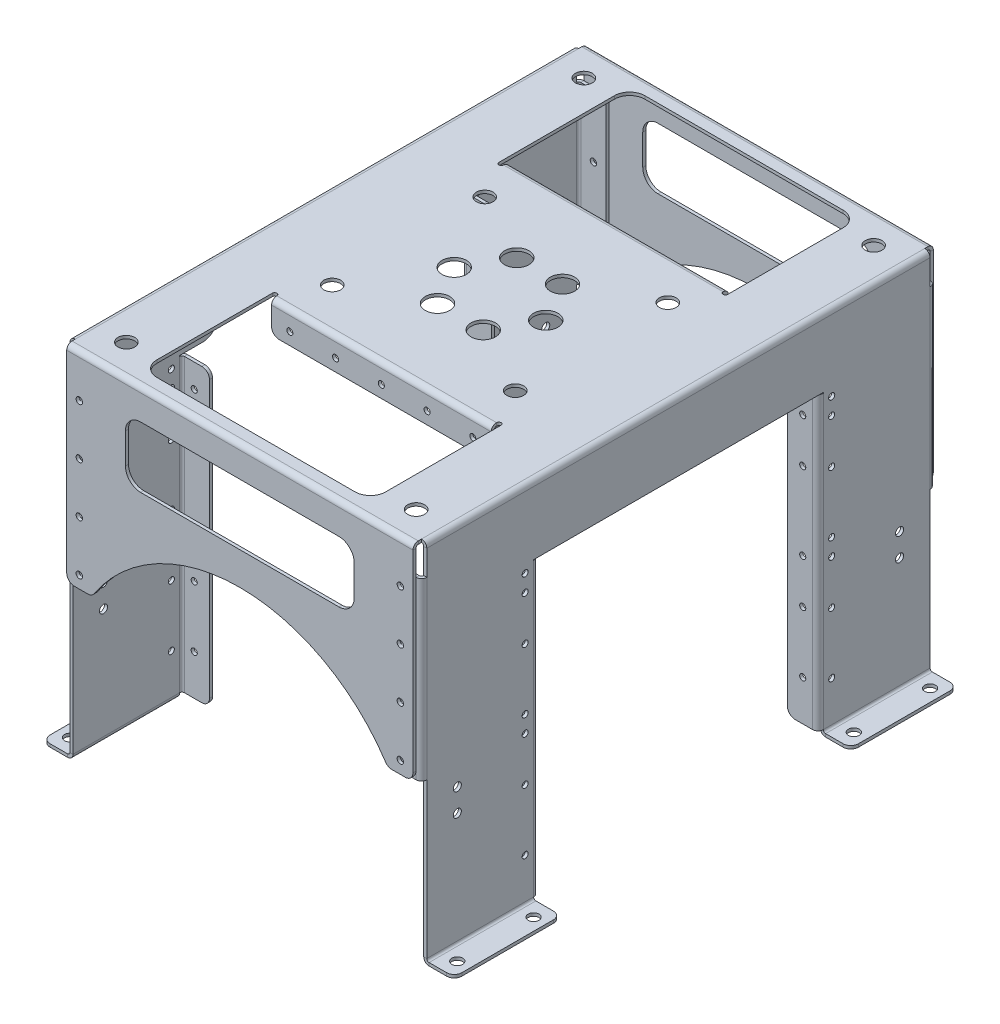
from build123d import *

# Parameters (mm, degrees)
SM_BASE_FLANGE_1_DEPTH           = 165
SM_EDGE_FLANGE_1_DEPTH           = 115
SM_EDGE_FLANGE_1_BEND_DEPTH      = 115
SM_EDGE_FLANGE_1_BEND_2_DEPTH    = 115
SM_EDGE_FLANGE_1_BEND_3_DEPTH    = 115
SM_EDGE_FLANGE_3_DEPTH           = 227
SM_START                         = 2
SM_EDGE_FLANGE_3_FLAT_DEPTH      = 2
HOLE_WIZARD_4_2_4_2_1_AT_2_COUNT = 2
HOLE_WIZARD_4_2_4_2_1_AT_2_PITCH = 33
HOLE_WIZARD_4_2_4_2_1_AT_3_COUNT = 2
HOLE_WIZARD_4_2_4_2_1_AT_3_PITCH = 66
HOLE_WIZARD_4_2_4_2_1_AT_4_COUNT = 2
HOLE_WIZARD_4_2_4_2_1_AT_4_PITCH = 99
HOLE_WIZARD_4_2_4_2_1_AT_5_COUNT = 2
HOLE_WIZARD_4_2_4_2_1_AT_5_PITCH = 232.618249499
HOLE_WIZARD_4_2_4_2_1_AT_6_COUNT = 2
HOLE_WIZARD_4_2_4_2_1_AT_6_PITCH = 220.60428373
HOLE_WIZARD_4_2_4_2_1_AT_7_COUNT = 2
HOLE_WIZARD_4_2_4_2_1_AT_7_PITCH = 213.070997557
HOLE_WIZARD_4_2_4_2_1_AT_8_COUNT = 2
HOLE_WIZARD_4_2_4_2_1_AT_8_PITCH = 210.5
F_11_DIAMETER_HOLE3_D            = 11
F_11_DIAMETER_HOLE3_DEPTH        = 5
F_11_DIAMETER_HOLE3_TIP          = 3.304733405
CUT_EXTRUDE_3_DEPTH              = 324.928016695
CUT_EXTRUDE_3_DEPTH_BACK         = 324.928016695
SKETCH_29_W                      = 190
SKETCH_29_H                      = 195
HOLE_WIZARD_M51_AT_2_COUNT       = 2
HOLE_WIZARD_M51_AT_2_PITCH       = 15
HOLE_WIZARD_M51_AT_3_COUNT       = 2
HOLE_WIZARD_M51_AT_3_PITCH       = 290
HOLE_WIZARD_M51_AT_4_COUNT       = 2
HOLE_WIZARD_M51_AT_4_PITCH       = 290.387671915
SM_EDGE_FLANGE_2_DEPTH           = 191
SM_EDGE_FLANGE_2_BEND_DEPTH      = 191
SM_EDGE_FLANGE_2_BEND_2_DEPTH    = 191
SM_EDGE_FLANGE_2_BEND_3_DEPTH    = 191
FILLET_1_R                       = 5
HOLE_WIZARD_7_1_7_1_1_D          = 7.1
HOLE_WIZARD_7_1_7_1_1_DEPTH      = 5
HOLE_WIZARD_7_1_7_1_1_TIP        = 2.133055198
CUT_EXTRUDE_6_DEPTH              = 439.454604264
CUT_EXTRUDE_7_DEPTH              = 10
F_11_DIAMETER_HOLE4_D            = 11
SKETCH_86_R                      = 8
CUT_EXTRUDE_8_DEPTH              = 10
HOLE_WIZARD_4_0_4_1_D            = 4
HOLE_WIZARD_4_0_4_1_DEPTH        = 10
HOLE_WIZARD_4_0_4_1_TIP          = 1.201721238
OTHER_START                      = 77.44041
OTHER_1_OUTLINE_W                = 144
OTHER_1_OUTLINE_H                = 2
OTHER_1_DEPTH                    = 17.55959
OTHER_START_2                    = 75.8
OTHER_1_2_OUTLINE_R              = 2
OTHER_1_2_DEPTH                  = 1.65959
OTHER_START_3                    = 74.3
OTHER_1_3_OUTLINE_R              = 2
OTHER_1_3_DEPTH                  = 3.5
OTHER_1_4_OUTLINE_W              = 144
OTHER_1_4_OUTLINE_H              = 2
OTHER_1_4_DEPTH                  = 0.14835
OTHER_START_4                    = -72
OTHER_1_5_DEPTH                  = 144
OTHER_START_5                    = -95
OTHER_2_OUTLINE_W                = 144
OTHER_2_OUTLINE_H                = 2
OTHER_2_DEPTH                    = 17.55959
OTHER_START_6                    = -77.45959
OTHER_2_2_OUTLINE_R              = 2
OTHER_2_2_DEPTH                  = 1.65959
OTHER_START_7                    = -77.8
OTHER_2_3_OUTLINE_R              = 2
OTHER_2_3_DEPTH                  = 3.5
OTHER_START_8                    = -77.58876
OTHER_2_4_OUTLINE_W              = 144
OTHER_2_4_OUTLINE_H              = 2
OTHER_2_4_DEPTH                  = 0.14835
OTHER_2_5_DEPTH                  = 144
HOLE_WIZARD_4_0_4_2_D            = 4
HOLE_START                       = -93.5
HOLE_WIZARD_4_0_4_3_OUTLINE_R    = 2
HOLE_WIZARD_4_0_4_3_DEPTH        = 187
SKETCH_106_W                     = 140
SKETCH_106_H                     = 30
CUT_EXTRUDE_10_DEPTH             = 10
FILLET_2_R                       = 10


with BuildPart() as part:
    # Базовая кромка1: sheet metal written as solids
    # Sketch 1 → Базовая кромка1 (new, symmetric)
    with BuildSketch(Plane.XY):
        with BuildLine():
            Line((-135, 0), (-118.5, 0))
            ThreePointArc((-118.5, 0), (-116.025126266, 1.025126266), (-115, 3.5))
            Line((-115, 3.5), (-115, 236.5))
            ThreePointArc((-115, 236.5), (-114.560660172, 237.560660172), (-113.5, 238))
            Line((-113.5, 238), (113.5, 238))
            ThreePointArc((113.5, 238), (114.560660172, 237.560660172), (115, 236.5))
            Line((115, 236.5), (115, 3.5))
            ThreePointArc((115, 3.5), (116.025126266, 1.025126266), (118.5, 0))
            Line((118.5, 0), (135, 0))
            Line((135, 0), (135, 2))
            Line((135, 2), (118.5, 2))
            ThreePointArc((118.5, 2), (117.439339828, 2.439339828), (117, 3.5))
            Line((117, 3.5), (117, 236.5))
            ThreePointArc((117, 236.5), (115.974873734, 238.974873734), (113.5, 240))
            Line((113.5, 240), (-113.5, 240))
            ThreePointArc((-113.5, 240), (-115.974873734, 238.974873734), (-117, 236.5))
            Line((-117, 236.5), (-117, 3.5))
            ThreePointArc((-117, 3.5), (-117.439339828, 2.439339828), (-118.5, 2))
            Line((-118.5, 2), (-135, 2))
            Line((-135, 2), (-135, 0))
        make_face()
    extrude(amount=SM_BASE_FLANGE_1_DEPTH, both=True)

    # Ребро-кромка1: sheet metal written as solids
    # Ребро-кромка1 section (on a plane across the edge) → Ребро-кромка1 (add)
    with BuildSketch(Plane(origin=(-115, 220, 166.5), x_dir=(0, 0, -1), z_dir=(0, -1, 0))):
        with BuildLine():
            Line((-2, 1.5), (-2, 18))
            Line((-2, 18), (0, 18))
            Line((0, 18), (0, 1.5))
            ThreePointArc((0, 1.5), (0.439339828, 0.439339828), (1.5, 0))
            Line((1.5, 0), (1.5, -2))
            ThreePointArc((1.5, -2), (-0.974873734, -0.974873734), (-2, 1.5))
        make_face()
    extrude(amount=SM_EDGE_FLANGE_1_DEPTH)

    # Ребро-кромка1 section 2 (on a plane across the edge) → Ребро-кромка1 bend (add)
    with BuildSketch(Plane(origin=(115, 105, 166.5), x_dir=(0, 0, -1), z_dir=(0, 1, 0))):
        with BuildLine():
            Line((-2, 1.5), (-2, 18))
            Line((-2, 18), (0, 18))
            Line((0, 18), (0, 1.5))
            ThreePointArc((0, 1.5), (0.439339828, 0.439339828), (1.5, 0))
            Line((1.5, 0), (1.5, -2))
            ThreePointArc((1.5, -2), (-0.974873734, -0.974873734), (-2, 1.5))
        make_face()
    extrude(amount=SM_EDGE_FLANGE_1_BEND_DEPTH)

    # Ребро-кромка1 section 3 (on a plane across the edge) → Ребро-кромка1 bend 2 (add)
    with BuildSketch(Plane(origin=(115, 220, -166.5), x_dir=(0, 0, 1), z_dir=(0, -1, 0))):
        with BuildLine():
            Line((-2, 1.5), (-2, 18))
            Line((-2, 18), (0, 18))
            Line((0, 18), (0, 1.5))
            ThreePointArc((0, 1.5), (0.439339828, 0.439339828), (1.5, 0))
            Line((1.5, 0), (1.5, -2))
            ThreePointArc((1.5, -2), (-0.974873734, -0.974873734), (-2, 1.5))
        make_face()
    extrude(amount=SM_EDGE_FLANGE_1_BEND_2_DEPTH)

    # Ребро-кромка1 section 4 (on a plane across the edge) → Ребро-кромка1 bend 3 (add)
    with BuildSketch(Plane(origin=(-115, 105, -166.5), x_dir=(0, 0, 1), z_dir=(0, 1, 0))):
        with BuildLine():
            Line((-2, 1.5), (-2, 18))
            Line((-2, 18), (0, 18))
            Line((0, 18), (0, 1.5))
            ThreePointArc((0, 1.5), (0.439339828, 0.439339828), (1.5, 0))
            Line((1.5, 0), (1.5, -2))
            ThreePointArc((1.5, -2), (-0.974873734, -0.974873734), (-2, 1.5))
        make_face()
    extrude(amount=SM_EDGE_FLANGE_1_BEND_3_DEPTH)

    # Ребро-кромка3: sheet metal written as solids
    # Ребро-кромка3 bend section (on a plane across the edge) → Ребро-кромка3 (add)
    with BuildSketch(Plane(origin=(113.5, 238, 168.6), x_dir=(0, 0, -1), z_dir=(-1, 0, 0))):
        with BuildLine():
            Line((-2, 1.5), (0, 1.5))
            ThreePointArc((0, 1.5), (0.439339828, 0.439339828), (1.5, 0))
            Line((1.5, 0), (3.6, 0))
            Line((3.6, 0), (3.6, -2))
            Line((3.6, -2), (1.5, -2))
            ThreePointArc((1.5, -2), (-0.974873734, -0.974873734), (-2, 1.5))
        make_face()
    sm_edge_flange_3 = extrude(amount=SM_EDGE_FLANGE_3_DEPTH)

    # Ребро-кромка3 profile (on flange) → Ребро-кромка3 flat (add)
    with BuildSketch(Plane(origin=(0, 238, 168.6), x_dir=(-1, 0, 0), z_dir=(0, 0, 1)).offset(SM_START)):
        with BuildLine():
            Line((-113.5, 1.5), (113.5, 1.5))
            Line((113.5, 1.5), (113.5, 128))
            ThreePointArc((113.5, 128), (112.035533906, 131.535533906), (108.5, 133))
            Line((108.5, 133), (99.72392953, 133))
            ThreePointArc((99.72392953, 133), (97.357241681, 132.404405593), (95.554388251, 130.759515451))
            ThreePointArc((95.554388251, 130.759515451), (0, 79.413787915), (-95.554388251, 130.759515451))
            ThreePointArc((-95.554388251, 130.759515451), (-97.357241681, 132.404405593), (-99.72392953, 133))
            Line((-99.72392953, 133), (-108.5, 133))
            ThreePointArc((-108.5, 133), (-112.035533906, 131.535533906), (-113.5, 128))
            Line((-113.5, 128), (-113.5, 1.5))
        make_face()
    sm_edge_flange_3_flat = extrude(amount=-SM_EDGE_FLANGE_3_FLAT_DEPTH)

    # Эскиз83 → Диаметр отверстия Ø4.2 (4.2)1 (revolve, cut)
    with BuildSketch(Plane(origin=(-105.25, 212, 170.6), x_dir=(0, -1, 0), z_dir=(1, 0, 0))):
        Polygon((0, 0), (0, 8.5118073), (2.1, 7.25), (2.1, 0), align=None)
    hole_wizard_4_2_4_2_1 = revolve(axis=Axis((-105.25, 212, 176.95), (0, 0, -1)), mode=Mode.SUBTRACT)

    # Диаметр отверстия Ø4.2 (4.2)1 at 2: Диаметр отверстия Ø4.2 (4.2)1 ×2
    with Locations(*[(0, -i * HOLE_WIZARD_4_2_4_2_1_AT_2_PITCH, 0) for i in range(1, HOLE_WIZARD_4_2_4_2_1_AT_2_COUNT)]):
        add(hole_wizard_4_2_4_2_1, mode=Mode.SUBTRACT)

    # Диаметр отверстия Ø4.2 (4.2)1 at 3: Диаметр отверстия Ø4.2 (4.2)1 ×2
    with Locations(*[(0, -i * HOLE_WIZARD_4_2_4_2_1_AT_3_PITCH, 0) for i in range(1, HOLE_WIZARD_4_2_4_2_1_AT_3_COUNT)]):
        add(hole_wizard_4_2_4_2_1, mode=Mode.SUBTRACT)

    # Диаметр отверстия Ø4.2 (4.2)1 at 4: Диаметр отверстия Ø4.2 (4.2)1 ×2
    with Locations(*[(0, -i * HOLE_WIZARD_4_2_4_2_1_AT_4_PITCH, 0) for i in range(1, HOLE_WIZARD_4_2_4_2_1_AT_4_COUNT)]):
        add(hole_wizard_4_2_4_2_1, mode=Mode.SUBTRACT)

    # Диаметр отверстия Ø4.2 (4.2)1 at 5: Диаметр отверстия Ø4.2 (4.2)1 ×2
    with Locations(*[Vector(0.9049161037593685, -0.42558999654240454, 0) * (i * HOLE_WIZARD_4_2_4_2_1_AT_5_PITCH) for i in range(1, HOLE_WIZARD_4_2_4_2_1_AT_5_COUNT)]):
        add(hole_wizard_4_2_4_2_1, mode=Mode.SUBTRACT)

    # Диаметр отверстия Ø4.2 (4.2)1 at 6: Диаметр отверстия Ø4.2 (4.2)1 ×2
    with Locations(*[Vector(0.9541972460411989, -0.2991782339131506, 0) * (i * HOLE_WIZARD_4_2_4_2_1_AT_6_PITCH) for i in range(1, HOLE_WIZARD_4_2_4_2_1_AT_6_COUNT)]):
        add(hole_wizard_4_2_4_2_1, mode=Mode.SUBTRACT)

    # Диаметр отверстия Ø4.2 (4.2)1 at 7: Диаметр отверстия Ø4.2 (4.2)1 ×2
    with Locations(*[Vector(0.9879336109248628, -0.15487795325662687, 0) * (i * HOLE_WIZARD_4_2_4_2_1_AT_7_PITCH) for i in range(1, HOLE_WIZARD_4_2_4_2_1_AT_7_COUNT)]):
        add(hole_wizard_4_2_4_2_1, mode=Mode.SUBTRACT)

    # Диаметр отверстия Ø4.2 (4.2)1 at 8: Диаметр отверстия Ø4.2 (4.2)1 ×2
    with Locations(*[(i * HOLE_WIZARD_4_2_4_2_1_AT_8_PITCH, 0, 0) for i in range(1, HOLE_WIZARD_4_2_4_2_1_AT_8_COUNT)]):
        add(hole_wizard_4_2_4_2_1, mode=Mode.SUBTRACT)

    # Зеркальное отражение3: Ребро-кромка3, Ребро-кромка3 flat, Диаметр отверстия Ø4.2 (4.2)1 across plane
    add(sm_edge_flange_3.mirror(Plane.XY))
    add(sm_edge_flange_3_flat.mirror(Plane.XY))
    add(hole_wizard_4_2_4_2_1.mirror(Plane.XY), mode=Mode.SUBTRACT)

    # Зеркальное отражение3 copy 1 sketch → Зеркальное отражение3 copy 1 (revolve, cut)
    with BuildSketch(Plane(origin=(-105.25, 179, -170.6), x_dir=(0, -1, 0), z_dir=(1, 0, 0))):
        Polygon((0, 0), (0, -8.5118073), (2.1, -7.25), (2.1, 0), align=None)
    revolve(axis=Axis((-105.25, 179, -176.95), (0, 0, -1)), mode=Mode.SUBTRACT)

    # Зеркальное отражение3 copy 2 sketch → Зеркальное отражение3 copy 2 (revolve, cut)
    with BuildSketch(Plane(origin=(-105.25, 146, -170.6), x_dir=(0, -1, 0), z_dir=(1, 0, 0))):
        Polygon((0, 0), (0, -8.5118073), (2.1, -7.25), (2.1, 0), align=None)
    revolve(axis=Axis((-105.25, 146, -176.95), (0, 0, -1)), mode=Mode.SUBTRACT)

    # Зеркальное отражение3 copy 3 sketch → Зеркальное отражение3 copy 3 (revolve, cut)
    with BuildSketch(Plane(origin=(-105.25, 113, -170.6), x_dir=(0, -1, 0), z_dir=(1, 0, 0))):
        Polygon((0, 0), (0, -8.5118073), (2.1, -7.25), (2.1, 0), align=None)
    revolve(axis=Axis((-105.25, 113, -176.95), (0, 0, -1)), mode=Mode.SUBTRACT)

    # Зеркальное отражение3 copy 4 sketch → Зеркальное отражение3 copy 4 (revolve, cut)
    with BuildSketch(Plane(origin=(105.25, 113, -170.6), x_dir=(0, -1, 0), z_dir=(1, 0, 0))):
        Polygon((0, 0), (0, -8.5118073), (2.1, -7.25), (2.1, 0), align=None)
    revolve(axis=Axis((105.25, 113, -176.95), (0, 0, -1)), mode=Mode.SUBTRACT)

    # Зеркальное отражение3 copy 5 sketch → Зеркальное отражение3 copy 5 (revolve, cut)
    with BuildSketch(Plane(origin=(105.25, 146, -170.6), x_dir=(0, -1, 0), z_dir=(1, 0, 0))):
        Polygon((0, 0), (0, -8.5118073), (2.1, -7.25), (2.1, 0), align=None)
    revolve(axis=Axis((105.25, 146, -176.95), (0, 0, -1)), mode=Mode.SUBTRACT)

    # Зеркальное отражение3 copy 6 sketch → Зеркальное отражение3 copy 6 (revolve, cut)
    with BuildSketch(Plane(origin=(105.25, 179, -170.6), x_dir=(0, -1, 0), z_dir=(1, 0, 0))):
        Polygon((0, 0), (0, -8.5118073), (2.1, -7.25), (2.1, 0), align=None)
    revolve(axis=Axis((105.25, 179, -176.95), (0, 0, -1)), mode=Mode.SUBTRACT)

    # Зеркальное отражение3 copy 7 sketch → Зеркальное отражение3 copy 7 (revolve, cut)
    with BuildSketch(Plane(origin=(105.25, 212, -170.6), x_dir=(0, -1, 0), z_dir=(1, 0, 0))):
        Polygon((0, 0), (0, -8.5118073), (2.1, -7.25), (2.1, 0), align=None)
    revolve(axis=Axis((105.25, 212, -176.95), (0, 0, -1)), mode=Mode.SUBTRACT)

    # 11_ Diameter Hole3
    with Locations(Plane(origin=(0, 240, 0), x_dir=(1, 0, 0), z_dir=(0, 1, 0))):
        with Locations((60, 50), (60, -50), (-60, 50), (-60, -50)):
            Hole(F_11_DIAMETER_HOLE3_D / 2, depth=F_11_DIAMETER_HOLE3_DEPTH)
            with Locations((0, 0, -(F_11_DIAMETER_HOLE3_DEPTH + F_11_DIAMETER_HOLE3_TIP / 2))):  # 118° drill point
                Cone(0, F_11_DIAMETER_HOLE3_D / 2, F_11_DIAMETER_HOLE3_TIP, mode=Mode.SUBTRACT)

    # Эскиз29 → Вырез-Вытянуть3 (cut, two sides: drawn at the far end of the back side and taken through both)
    with BuildSketch(Plane(origin=(0, 0, 0), x_dir=(0, 0, -1), z_dir=(1, 0, 0)).offset(-CUT_EXTRUDE_3_DEPTH_BACK)):
        with Locations((0, 97.5)):
            Rectangle(SKETCH_29_W, SKETCH_29_H)
    extrude(amount=CUT_EXTRUDE_3_DEPTH + CUT_EXTRUDE_3_DEPTH_BACK, mode=Mode.SUBTRACT)

    # Эскиз33 → Отверстие с зазором M51 (revolve, cut)
    with BuildSketch(Plane(origin=(117, 91, 145), x_dir=(0, 0, -1), z_dir=(0, 1, 0))):
        Polygon((0, 0), (0, 6.59228064), (2.65, 5), (2.65, 0), align=None)
    hole_wizard_m51 = revolve(axis=Axis((123.35, 91, 145), (-1, 0, 0)), mode=Mode.SUBTRACT)

    # Отверстие с зазором M51 at 2: Отверстие с зазором M51 ×2
    with Locations(*[(0, -i * HOLE_WIZARD_M51_AT_2_PITCH, 0) for i in range(1, HOLE_WIZARD_M51_AT_2_COUNT)]):
        add(hole_wizard_m51, mode=Mode.SUBTRACT)

    # Отверстие с зазором M51 at 3: Отверстие с зазором M51 ×2
    with Locations(*[(0, 0, -i * HOLE_WIZARD_M51_AT_3_PITCH) for i in range(1, HOLE_WIZARD_M51_AT_3_COUNT)]):
        add(hole_wizard_m51, mode=Mode.SUBTRACT)

    # Отверстие с зазором M51 at 4: Отверстие с зазором M51 ×2
    with Locations(*[Vector(0, -0.0516550854280424, -0.9986649849421084) * (i * HOLE_WIZARD_M51_AT_4_PITCH) for i in range(1, HOLE_WIZARD_M51_AT_4_COUNT)]):
        add(hole_wizard_m51, mode=Mode.SUBTRACT)

    # Зеркальное отражение2: Отверстие с зазором M51 across plane
    add(hole_wizard_m51.mirror(Plane(origin=(0, 0, 0), x_dir=(0, 0, 1), z_dir=(1, 0, 0))), mode=Mode.SUBTRACT)

    # Зеркальное отражение2 copy 1 sketch → Зеркальное отражение2 copy 1 (revolve, cut)
    with BuildSketch(Plane(origin=(-117, 76, 145), x_dir=(0, 0, -1), z_dir=(0, 1, 0))):
        Polygon((0, 0), (0, -6.59228064), (2.65, -5), (2.65, 0), align=None)
    revolve(axis=Axis((-123.35, 76, 145), (-1, 0, 0)), mode=Mode.SUBTRACT)

    # Зеркальное отражение2 copy 2 sketch → Зеркальное отражение2 copy 2 (revolve, cut)
    with BuildSketch(Plane(origin=(-117, 91, -145), x_dir=(0, 0, -1), z_dir=(0, 1, 0))):
        Polygon((0, 0), (0, -6.59228064), (2.65, -5), (2.65, 0), align=None)
    revolve(axis=Axis((-123.35, 91, -145), (-1, 0, 0)), mode=Mode.SUBTRACT)

    # Зеркальное отражение2 copy 3 sketch → Зеркальное отражение2 copy 3 (revolve, cut)
    with BuildSketch(Plane(origin=(-117, 76, -145), x_dir=(0, 0, -1), z_dir=(0, 1, 0))):
        Polygon((0, 0), (0, -6.59228064), (2.65, -5), (2.65, 0), align=None)
    revolve(axis=Axis((-123.35, 76, -145), (-1, 0, 0)), mode=Mode.SUBTRACT)

    # Ребро-кромка2: sheet metal written as solids
    # Ребро-кромка2 section (on a plane across the edge) → Ребро-кромка2 (add)
    with BuildSketch(Plane(origin=(115, 3.5, -93.5), x_dir=(0, 0, -1), z_dir=(0, 1, 0))):
        with BuildLine():
            Line((-2, 1.5), (-2, 18))
            Line((-2, 18), (0, 18))
            Line((0, 18), (0, 1.5))
            ThreePointArc((0, 1.5), (0.439339828, 0.439339828), (1.5, 0))
            Line((1.5, 0), (1.5, -2))
            ThreePointArc((1.5, -2), (-0.974873734, -0.974873734), (-2, 1.5))
        make_face()
    extrude(amount=SM_EDGE_FLANGE_2_DEPTH)

    # Ребро-кромка2 section 2 (on a plane across the edge) → Ребро-кромка2 bend (add)
    with BuildSketch(Plane(origin=(-115, 194.5, -93.5), x_dir=(0, 0, -1), z_dir=(0, -1, 0))):
        with BuildLine():
            Line((-2, 1.5), (-2, 18))
            Line((-2, 18), (0, 18))
            Line((0, 18), (0, 1.5))
            ThreePointArc((0, 1.5), (0.439339828, 0.439339828), (1.5, 0))
            Line((1.5, 0), (1.5, -2))
            ThreePointArc((1.5, -2), (-0.974873734, -0.974873734), (-2, 1.5))
        make_face()
    extrude(amount=SM_EDGE_FLANGE_2_BEND_DEPTH)

    # Ребро-кромка2 section 3 (on a plane across the edge) → Ребро-кромка2 bend 2 (add)
    with BuildSketch(Plane(origin=(-115, 3.5, 93.5), x_dir=(0, 0, 1), z_dir=(0, 1, 0))):
        with BuildLine():
            Line((-2, 1.5), (-2, 18))
            Line((-2, 18), (0, 18))
            Line((0, 18), (0, 1.5))
            ThreePointArc((0, 1.5), (0.439339828, 0.439339828), (1.5, 0))
            Line((1.5, 0), (1.5, -2))
            ThreePointArc((1.5, -2), (-0.974873734, -0.974873734), (-2, 1.5))
        make_face()
    extrude(amount=SM_EDGE_FLANGE_2_BEND_2_DEPTH)

    # Ребро-кромка2 section 4 (on a plane across the edge) → Ребро-кромка2 bend 3 (add)
    with BuildSketch(Plane(origin=(115, 194.5, 93.5), x_dir=(0, 0, 1), z_dir=(0, -1, 0))):
        with BuildLine():
            Line((-2, 1.5), (-2, 18))
            Line((-2, 18), (0, 18))
            Line((0, 18), (0, 1.5))
            ThreePointArc((0, 1.5), (0.439339828, 0.439339828), (1.5, 0))
            Line((1.5, 0), (1.5, -2))
            ThreePointArc((1.5, -2), (-0.974873734, -0.974873734), (-2, 1.5))
        make_face()
    extrude(amount=SM_EDGE_FLANGE_2_BEND_3_DEPTH)

    # Скругление1
    fillet_1_edges = [part.edges().sort_by_distance(p)[0] for p in [
        (97, 105, 167.5),
        (97, 105, -167.5),
        (-97, 105, -167.5),
        (-135, 1, -165),
        (135, 1, -165),
        (-135, 1, 165),
        (-135, 1, 95),
        (-135, 1, -95),
        (135, 1, -95),
        (135, 1, 95),
        (97, 3.5, -92.5),
        (97, 194.5, -92.5),
        (-97, 194.5, -92.5),
        (-97, 3.5, -92.5),
        (-97, 3.5, 92.5),
        (-97, 194.5, 92.5),
        (97, 194.5, 92.5),
        (97, 3.5, 92.5),
        (135, 1, 165),
        (-97, 105, 167.5),
    ]]
    fillet(fillet_1_edges, radius=FILLET_1_R)

    # Диаметр отверстия Ø7.1 (7.1)1
    with Locations(Plane(origin=(0, 2, 0), x_dir=(1, 0, 0), z_dir=(0, 1, 0))):
        with Locations((127, 155), (127, 105), (127, -105), (127, -155), (-127, 155), (-127, 105), (-127, -105), (-127, -155)):
            Hole(HOLE_WIZARD_7_1_7_1_1_D / 2, depth=HOLE_WIZARD_7_1_7_1_1_DEPTH)
            with Locations((0, 0, -(HOLE_WIZARD_7_1_7_1_1_DEPTH + HOLE_WIZARD_7_1_7_1_1_TIP / 2))):  # 118° drill point
                Cone(0, HOLE_WIZARD_7_1_7_1_1_D / 2, HOLE_WIZARD_7_1_7_1_1_TIP, mode=Mode.SUBTRACT)

    # Эскиз80 → Вырез-Вытянуть6 (cut, through all)
    with BuildSketch(Plane.XY.offset(170.6)):
        with BuildLine():
            Line((-65, 180), (65, 180))
            ThreePointArc((65, 180), (72.071067812, 182.928932188), (75, 190))
            Line((75, 190), (75, 210))
            ThreePointArc((75, 210), (72.071067812, 217.071067812), (65, 220))
            Line((65, 220), (-65, 220))
            ThreePointArc((-65, 220), (-72.071067812, 217.071067812), (-75, 210))
            Line((-75, 210), (-75, 190))
            ThreePointArc((-75, 190), (-72.071067812, 182.928932188), (-65, 180))
        make_face()
    extrude(amount=-CUT_EXTRUDE_6_DEPTH, mode=Mode.SUBTRACT)

    # Эскиз81 → Вырез-Вытянуть7 (cut)
    with BuildSketch(Plane(origin=(0, 240, 0), x_dir=(1, 0, 0), z_dir=(0, 1, 0))):
        with BuildLine():
            Line((-65, -160), (65, -160))
            ThreePointArc((65, -160), (72.071067812, -157.071067812), (75, -150))
            Line((75, -150), (75, -74.3))
            ThreePointArc((75, -74.3), (73.5, -72.8), (72, -74.3))
            Line((72, -74.3), (72, -90))
            ThreePointArc((72, -90), (70.535533906, -93.535533906), (67, -95))
            Line((67, -95), (-67, -95))
            ThreePointArc((-67, -95), (-70.535533906, -93.535533906), (-72, -90))
            Line((-72, -90), (-72, -74.3))
            ThreePointArc((-72, -74.3), (-73.5, -72.8), (-75, -74.3))
            Line((-75, -74.3), (-75, -150))
            ThreePointArc((-75, -150), (-72.071067812, -157.071067812), (-65, -160))
        make_face()
        with BuildLine():
            Line((-72, 74.3), (-72, 90))
            ThreePointArc((-72, 90), (-70.535533906, 93.535533906), (-67, 95))
            Line((-67, 95), (67, 95))
            ThreePointArc((67, 95), (70.535533906, 93.535533906), (72, 90))
            Line((72, 90), (72, 74.3))
            ThreePointArc((72, 74.3), (73.5, 72.8), (75, 74.3))
            Line((75, 74.3), (75, 150))
            ThreePointArc((75, 150), (72.071067812, 157.071067812), (65, 160))
            Line((65, 160), (-65, 160))
            ThreePointArc((-65, 160), (-72.071067812, 157.071067812), (-75, 150))
            Line((-75, 150), (-75, 74.3))
            ThreePointArc((-75, 74.3), (-73.5, 72.8), (-72, 74.3))
        make_face()
    extrude(amount=-CUT_EXTRUDE_7_DEPTH, mode=Mode.SUBTRACT)

    # 11_ Diameter Hole4 (through all)
    with Locations(Plane(origin=(0, 240, 0), x_dir=(1, 0, 0), z_dir=(0, 1, 0))):
        with Locations((-95, 150), (95, 150), (95, -150), (-95, -150)):
            Hole(F_11_DIAMETER_HOLE4_D / 2)

    # Эскиз86 → Вырез-Вытянуть8 (cut)
    with BuildSketch(Plane(origin=(0, 240, 0), x_dir=(1, 0, 0), z_dir=(0, 1, 0))):
        with Locations(Location((-15, -25.980762114, 0), (0, 0, 270))):
            Circle(SKETCH_86_R)
        with Locations(Location((15, -25.980762114, 0), (0, 0, 270))):
            Circle(SKETCH_86_R)
        with Locations(Location((-30, 0, 0), (0, 0, 270))):
            Circle(SKETCH_86_R)
        with Locations(Location((-15, 25.980762114, 0), (0, 0, 270))):
            Circle(SKETCH_86_R)
        with Locations(Location((15, 25.980762114, 0), (0, 0, 270))):
            Circle(SKETCH_86_R)
        with Locations(Location((30, 0, 0), (0, 0, 270))):
            Circle(SKETCH_86_R)
    extrude(amount=-CUT_EXTRUDE_8_DEPTH, mode=Mode.SUBTRACT)

    # Диаметр отверстия Ø4.0 (4)1
    with Locations(Plane(origin=(0, 240, 0), x_dir=(1, 0, 0), z_dir=(0, 1, 0))):
        with Locations((-60, -87), (-30, -87), (0, -87), (30, -87), (60, -87), (-60, 87), (-30, 87), (0, 87), (30, 87), (60, 87)):
            Hole(HOLE_WIZARD_4_0_4_1_D / 2, depth=HOLE_WIZARD_4_0_4_1_DEPTH)
            with Locations((0, 0, -(HOLE_WIZARD_4_0_4_1_DEPTH + HOLE_WIZARD_4_0_4_1_TIP / 2))):  # 118° drill point
                Cone(0, HOLE_WIZARD_4_0_4_1_D / 2, HOLE_WIZARD_4_0_4_1_TIP, mode=Mode.SUBTRACT)

    # Other 1: read off the stored shape, not the designer's step
    # Other 1 outline → Other 1 (cut)
    with BuildSketch(Plane.XY.offset(OTHER_START)):
        with Locations((0, 239)):
            Rectangle(OTHER_1_OUTLINE_W, OTHER_1_OUTLINE_H)
    extrude(amount=OTHER_1_DEPTH, mode=Mode.SUBTRACT)

    # Other 1 2 outline → Other 1 2 (add)
    with BuildSketch(Plane.XY.offset(OTHER_START_2)):
        with BuildLine():
            Line((72, 238), (-72, 238))
            Line((-72, 238), (-72, 224.412831552))
            ThreePointArc((-72, 224.412831552), (-70.535533906, 220.877297646), (-67, 219.412831552))
            Line((-67, 219.412831552), (67, 219.412831552))
            ThreePointArc((67, 219.412831552), (70.535533906, 220.877297646), (72, 224.412831552))
            Line((72, 224.412831552), (72, 238))
        make_face()
        with Locations((-60, 227.412831552)):
            Circle(OTHER_1_2_OUTLINE_R, mode=Mode.SUBTRACT)
        with Locations((-30, 227.412831552)):
            Circle(OTHER_1_2_OUTLINE_R, mode=Mode.SUBTRACT)
        with Locations((0, 227.412831552)):
            Circle(OTHER_1_2_OUTLINE_R, mode=Mode.SUBTRACT)
        with Locations((30, 227.412831552)):
            Circle(OTHER_1_2_OUTLINE_R, mode=Mode.SUBTRACT)
        with Locations((60, 227.412831552)):
            Circle(OTHER_1_2_OUTLINE_R, mode=Mode.SUBTRACT)
    extrude(amount=OTHER_1_2_DEPTH)

    # Other 1 3 outline → Other 1 3 (add)
    with BuildSketch(Plane.XY.offset(OTHER_START_3)):
        with BuildLine():
            Line((-72, 238), (-72, 224.412831552))
            ThreePointArc((-72, 224.412831552), (-70.535533906, 220.877297646), (-67, 219.412831552))
            Line((-67, 219.412831552), (67, 219.412831552))
            ThreePointArc((67, 219.412831552), (70.535533906, 220.877297646), (72, 224.412831552))
            Line((72, 224.412831552), (72, 238))
            Line((72, 238), (-72, 238))
        make_face()
        with Locations((-60, 227.412831552)):
            Circle(OTHER_1_3_OUTLINE_R, mode=Mode.SUBTRACT)
        with Locations((-30, 227.412831552)):
            Circle(OTHER_1_3_OUTLINE_R, mode=Mode.SUBTRACT)
        with Locations((0, 227.412831552)):
            Circle(OTHER_1_3_OUTLINE_R, mode=Mode.SUBTRACT)
        with Locations((30, 227.412831552)):
            Circle(OTHER_1_3_OUTLINE_R, mode=Mode.SUBTRACT)
        with Locations((60, 227.412831552)):
            Circle(OTHER_1_3_OUTLINE_R, mode=Mode.SUBTRACT)
    extrude(amount=OTHER_1_3_DEPTH)

    # Other 1 4 outline → Other 1 4 (add)
    with BuildSketch(Plane.XY.offset(OTHER_START)):
        with Locations((0, 239)):
            Rectangle(OTHER_1_4_OUTLINE_W, OTHER_1_4_OUTLINE_H)
    extrude(amount=OTHER_1_4_DEPTH)

    # Other 1 5 outline → Other 1 5 (cut)
    with BuildSketch(Plane.YZ.offset(OTHER_START_4)):
        with BuildLine():
            Line((236.5, 75.8), (219.412831552, 75.8))
            Line((219.412831552, 75.8), (219.412831552, 74.3))
            Line((219.412831552, 74.3), (238, 74.3))
            ThreePointArc((238, 74.3), (237.560660172, 75.360660172), (236.5, 75.8))
        make_face()
        with BuildLine():
            ThreePointArc((236.5, 77.8), (238.974873734, 76.774873734), (240, 74.3))
            Line((240, 74.3), (240, 77.58876))
            Line((240, 77.58876), (238, 77.58876))
            Line((238, 77.58876), (238, 77.8))
            Line((238, 77.8), (236.5, 77.8))
        make_face()
    extrude(amount=OTHER_1_5_DEPTH, mode=Mode.SUBTRACT)

    # Other 2: read off the stored shape, not the designer's step
    # Other 2 outline → Other 2 (cut)
    with BuildSketch(Plane.XY.offset(OTHER_START_5)):
        with Locations((0, 239)):
            Rectangle(OTHER_2_OUTLINE_W, OTHER_2_OUTLINE_H)
    extrude(amount=OTHER_2_DEPTH, mode=Mode.SUBTRACT)

    # Other 2 2 outline → Other 2 2 (add)
    with BuildSketch(Plane.XY.offset(OTHER_START_6)):
        with BuildLine():
            Line((72, 224.412831552), (72, 238))
            Line((72, 238), (-72, 238))
            Line((-72, 238), (-72, 224.412831552))
            ThreePointArc((-72, 224.412831552), (-70.535533906, 220.877297646), (-67, 219.412831552))
            Line((-67, 219.412831552), (67, 219.412831552))
            ThreePointArc((67, 219.412831552), (70.535533906, 220.877297646), (72, 224.412831552))
        make_face()
        with Locations((-60, 227.412831552)):
            Circle(OTHER_2_2_OUTLINE_R, mode=Mode.SUBTRACT)
        with Locations((-30, 227.412831552)):
            Circle(OTHER_2_2_OUTLINE_R, mode=Mode.SUBTRACT)
        with Locations((0, 227.412831552)):
            Circle(OTHER_2_2_OUTLINE_R, mode=Mode.SUBTRACT)
        with Locations((30, 227.412831552)):
            Circle(OTHER_2_2_OUTLINE_R, mode=Mode.SUBTRACT)
        with Locations((60, 227.412831552)):
            Circle(OTHER_2_2_OUTLINE_R, mode=Mode.SUBTRACT)
    extrude(amount=OTHER_2_2_DEPTH)

    # Other 2 3 outline → Other 2 3 (add)
    with BuildSketch(Plane.XY.offset(OTHER_START_7)):
        with BuildLine():
            Line((72, 224.412831552), (72, 238))
            Line((72, 238), (-72, 238))
            Line((-72, 238), (-72, 224.412831552))
            ThreePointArc((-72, 224.412831552), (-70.535533906, 220.877297646), (-67, 219.412831552))
            Line((-67, 219.412831552), (67, 219.412831552))
            ThreePointArc((67, 219.412831552), (70.535533906, 220.877297646), (72, 224.412831552))
        make_face()
        with Locations((-60, 227.412831552)):
            Circle(OTHER_2_3_OUTLINE_R, mode=Mode.SUBTRACT)
        with Locations((-30, 227.412831552)):
            Circle(OTHER_2_3_OUTLINE_R, mode=Mode.SUBTRACT)
        with Locations((0, 227.412831552)):
            Circle(OTHER_2_3_OUTLINE_R, mode=Mode.SUBTRACT)
        with Locations((30, 227.412831552)):
            Circle(OTHER_2_3_OUTLINE_R, mode=Mode.SUBTRACT)
        with Locations((60, 227.412831552)):
            Circle(OTHER_2_3_OUTLINE_R, mode=Mode.SUBTRACT)
    extrude(amount=OTHER_2_3_DEPTH)

    # Other 2 4 outline → Other 2 4 (add)
    with BuildSketch(Plane.XY.offset(OTHER_START_8)):
        with Locations((0, 239)):
            Rectangle(OTHER_2_4_OUTLINE_W, OTHER_2_4_OUTLINE_H)
    extrude(amount=OTHER_2_4_DEPTH)

    # Other 2 5 outline → Other 2 5 (cut)
    with BuildSketch(Plane.YZ.offset(OTHER_START_4)):
        with BuildLine():
            Line((240, -77.58876), (240, -74.3))
            ThreePointArc((240, -74.3), (238.974873734, -76.774873734), (236.5, -77.8))
            Line((236.5, -77.8), (238, -77.8))
            Line((238, -77.8), (238, -77.58876))
            Line((238, -77.58876), (240, -77.58876))
        make_face()
        with BuildLine():
            Line((219.412831552, -74.3), (219.412831552, -75.8))
            Line((219.412831552, -75.8), (236.5, -75.8))
            ThreePointArc((236.5, -75.8), (237.560660172, -75.360660172), (238, -74.3))
            Line((238, -74.3), (219.412831552, -74.3))
        make_face()
    extrude(amount=OTHER_2_5_DEPTH, mode=Mode.SUBTRACT)

    # Диаметр отверстия Ø4.0 (4)2 (through all)
    with Locations(Plane.ZY.offset(117)):
        with Locations((-100.5, 190), (-100.5, 150), (-100.5, 110), (-100.5, 70), (-100.5, 30), (100.5, 30), (100.5, 70), (100.5, 110), (100.5, 150), (100.5, 190), (-100.5, 179), (-100.5, 99), (100.5, 99), (100.5, 179)):
            Hole(HOLE_WIZARD_4_0_4_2_D / 2)

    # Диаметр отверстия Ø4.0 (4)3: read off the stored shape, not the designer's step
    # Диаметр отверстия Ø4.0 (4)3 outline → Диаметр отверстия Ø4.0 (4)3 (cut)
    with BuildSketch(Plane.XY.offset(HOLE_START)):
        with Locations((107, 179)):
            Circle(HOLE_WIZARD_4_0_4_3_OUTLINE_R)
        with Locations((107, 150)):
            Circle(HOLE_WIZARD_4_0_4_3_OUTLINE_R)
        with Locations((107, 99)):
            Circle(HOLE_WIZARD_4_0_4_3_OUTLINE_R)
        with Locations((107, 70)):
            Circle(HOLE_WIZARD_4_0_4_3_OUTLINE_R)
        with Locations((107, 30)):
            Circle(HOLE_WIZARD_4_0_4_3_OUTLINE_R)
        with Locations((-107, 70)):
            Circle(HOLE_WIZARD_4_0_4_3_OUTLINE_R)
        with Locations((-107, 30)):
            Circle(HOLE_WIZARD_4_0_4_3_OUTLINE_R)
        with Locations((-107, 99)):
            Circle(HOLE_WIZARD_4_0_4_3_OUTLINE_R)
        with Locations((-107, 150)):
            Circle(HOLE_WIZARD_4_0_4_3_OUTLINE_R)
        with Locations((-107, 179)):
            Circle(HOLE_WIZARD_4_0_4_3_OUTLINE_R)
    extrude(amount=HOLE_WIZARD_4_0_4_3_DEPTH, mode=Mode.SUBTRACT)

    # Эскиз106 → Вырез-Вытянуть10 (cut)
    with BuildSketch(Plane.ZY.offset(117)):
        with Locations((0, 210)):
            Rectangle(SKETCH_106_W, SKETCH_106_H)
    extrude(amount=-CUT_EXTRUDE_10_DEPTH, mode=Mode.SUBTRACT)

    # Скругление2
    fillet_2_edges = [part.edges().sort_by_distance(p)[0] for p in [
        (-116, 195, -70),
        (-116, 225, -70),
        (-116, 225, 70),
        (-116, 195, 70),
    ]]
    fillet(fillet_2_edges, radius=FILLET_2_R)


solid = part.part
